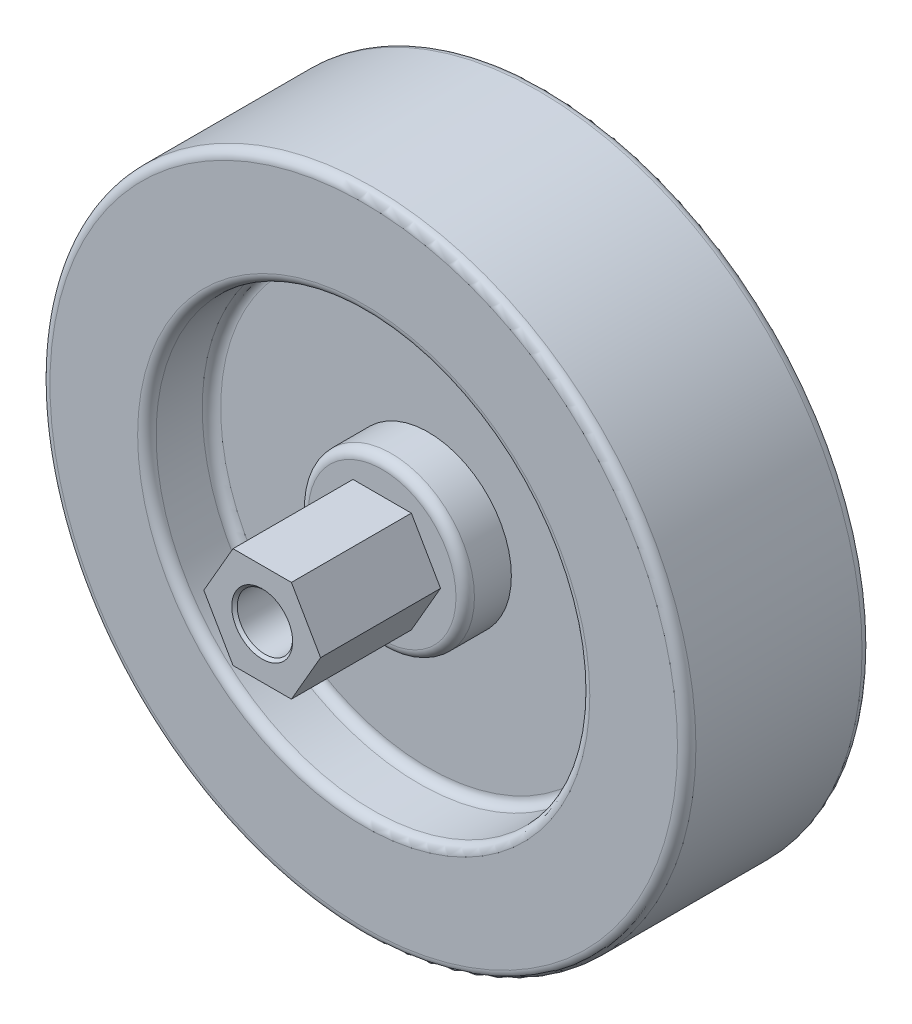
from build123d import *

# Parameters (mm, degrees)
SKETCH_1_R          = 35
SKETCH_1_R_2        = 23.5
EXTRUDE_1_DEPTH     = 20
SKETCH_2_R          = 23.5
EXTRUDE_2_DEPTH     = 18
EXTRUDE_3_DEPTH     = 13
CUT_EXTRUDE_START   = -5
SKETCH_4_R          = 23.5
SKETCH_4_R_2        = 9
CUT_EXTRUDE_1_DEPTH = 5
SKETCH_5_R          = 3
CUT_EXTRUDE_2_DEPTH = 12
SKETCH_7_R          = 24
CUT_EXTRUDE_3_DEPTH = 2
FILLET_1_R          = 1
CHAMFER_1_SIZE      = 0.3


with BuildPart() as part:
    # 草图1 → 凸台-拉伸1 (new body)
    with BuildSketch(Plane.XY):
        Circle(SKETCH_1_R)
        Circle(SKETCH_1_R_2, mode=Mode.SUBTRACT)
    extrude(amount=EXTRUDE_1_DEPTH)

    # 草图2 → 凸台-拉伸2 (add)
    with BuildSketch(Plane.XY):
        Circle(SKETCH_2_R)
    extrude(amount=EXTRUDE_2_DEPTH)

    # 草图3 → 凸台-拉伸3 (add)
    with BuildSketch(Plane.XY.offset(18)):
        Polygon((6.327155881, 0), (3.163577941, 5.479477727), (-3.163577941, 5.479477727), (-6.327155881, 0), (-3.163577941, -5.479477727), (3.163577941, -5.479477727), align=None)
    extrude(amount=EXTRUDE_3_DEPTH)

    # 草图4 → 切除-拉伸1 (cut)
    with BuildSketch(Plane.XY.offset(18).offset(CUT_EXTRUDE_START)):
        Circle(SKETCH_4_R)
        Circle(SKETCH_4_R_2, mode=Mode.SUBTRACT)
    extrude(amount=CUT_EXTRUDE_1_DEPTH, mode=Mode.SUBTRACT)

    # 草图5 → 切除-拉伸2 (cut)
    with BuildSketch(Plane.XY.offset(31)):
        Circle(SKETCH_5_R)
    extrude(amount=-CUT_EXTRUDE_2_DEPTH, mode=Mode.SUBTRACT)

    # 草图7 → 切除-拉伸3 (cut)
    with BuildSketch(Plane(origin=(0, 0, 0), x_dir=(-1, 0, 0), z_dir=(0, 0, -1))):
        Circle(SKETCH_7_R)
    extrude(amount=-CUT_EXTRUDE_3_DEPTH, mode=Mode.SUBTRACT)

    # 圆角1
    fillet_1_edges = [part.edges().sort_by_distance(p)[0] for p in [
        (-35, 0, 0),
        (-23.5, 0, 13),
        (-9, 0, 18),
        (24, 0, 2),
        (24, 0, 0),
        (-35, 0, 20),
        (-23.5, 0, 20),
    ]]
    fillet(fillet_1_edges, radius=FILLET_1_R - 0.0001)  # a hair under: the kernel refuses the full size

    # 倒角1
    chamfer_1_edges = [part.edges().sort_by_distance(p)[0] for p in [
        (-3, 0, 31),
    ]]
    chamfer(chamfer_1_edges, length=CHAMFER_1_SIZE)


solid = part.part
